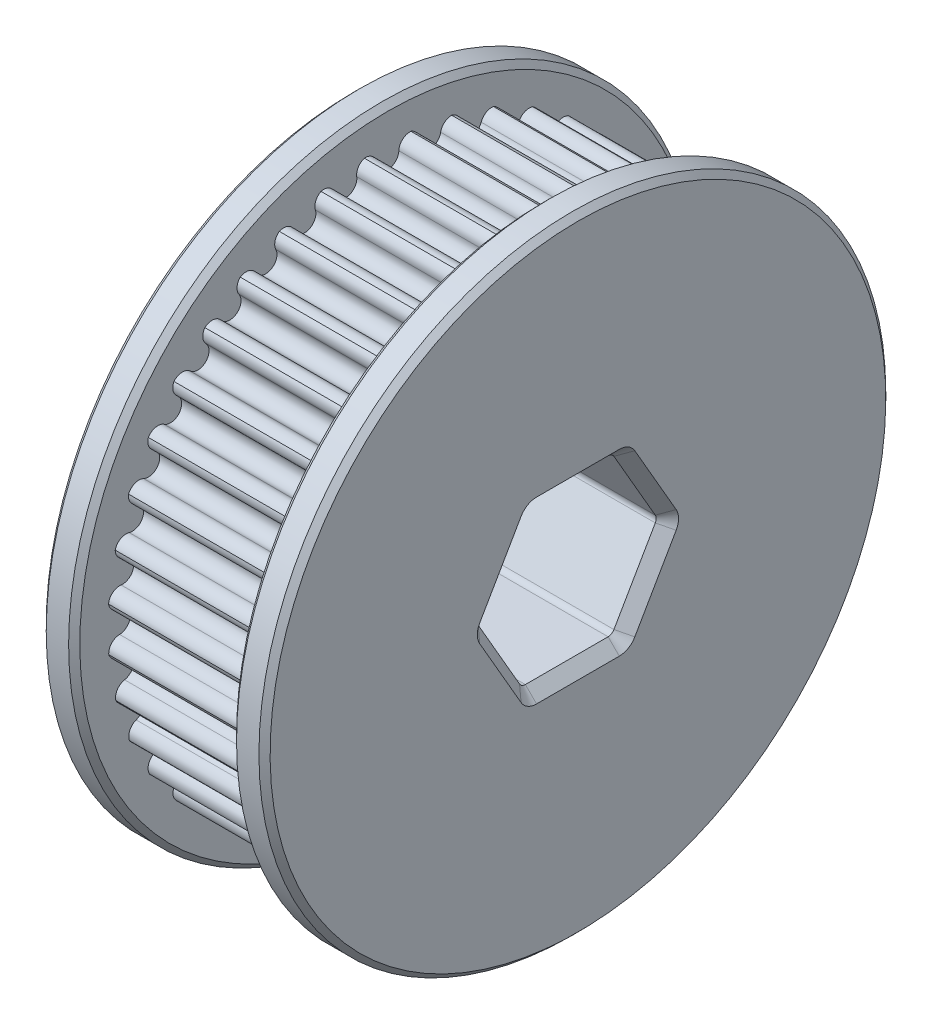
from build123d import *

# Parameters (mm, degrees)
CUT_EXTRUDE1_START       = -16.5
CUT_EXTRUDE1_OUTLINE_R   = 4
CUT_EXTRUDE1_DEPTH       = 9.5
CUT_EXTRUDE1_START_2     = -16.75
CUT_EXTRUDE1_2_OUTLINE_R = 14
CUT_EXTRUDE1_2_DEPTH     = 1
CUT_EXTRUDE1_START_3     = -8.25
CUT_EXTRUDE1_3_OUTLINE_R = 14
CUT_EXTRUDE1_3_DEPTH     = 1
SKETCH2_R                = 6.324330015
BOSS_EXTRUDE1_DEPTH      = 10
CUT_EXTRUDE2_REACH       = 24.181
CHAMFER1_SIZE            = 0.5
SKETCH4_R                = 5.85
SKETCH4_R_2              = 4.85
BOSS_EXTRUDE2_DEPTH      = 0.5


with BuildPart() as part:
    # Cut-Extrude1: read off the stored shape, not the designer's step
    # Cut-Extrude1 outline → Cut-Extrude1 (new body)
    with BuildSketch(Plane(origin=(17, 0, 0), x_dir=(0, 0, -1), z_dir=(1, 0, 0)).offset(CUT_EXTRUDE1_START)):
        with BuildLine():
            ThreePointArc((1.041143378, 12.456565356), (0.66686285, 12.331604355), (0.499748821, 11.974149369))
            ThreePointArc((0.499748821, 11.974149369), (0, 11.489995997), (-0.499748821, 11.974149369))
            ThreePointArc((-0.499748821, 11.974149369), (-0.66686285, 12.331604355), (-1.041143378, 12.456565356))
            ThreePointArc((-1.041143378, 12.456565356), (-1.309730051, 12.245866404), (-1.380507466, 11.9119152))
            ThreePointArc((-1.380507466, 11.9119152), (-1.793941124, 11.349100539), (-2.366765735, 11.748549781))
            ThreePointArc((-2.366765735, 11.748549781), (-2.587740592, 12.075461509), (-2.976961313, 12.140333659))
            ThreePointArc((-2.976961313, 12.140333659), (-3.20928066, 11.890212548), (-3.226945211, 11.54930081))
            ThreePointArc((-3.226945211, 11.54930081), (-3.547245203, 10.928740058), (-4.175505021, 11.233661906))
            ThreePointArc((-4.175505021, 11.233661906), (-4.444899572, 11.521980725), (-4.83947658, 11.525166655))
            ThreePointArc((-4.83947658, 11.525166655), (-5.029808129, 11.241782197), (-4.993924854, 10.902304304))
            ThreePointArc((-4.993924854, 10.902304304), (-5.213204333, 10.239277727), (-5.881429516, 10.442163992))
            ThreePointArc((-5.881429516, 10.442163992), (-6.192610373, 10.684790536), (-6.582827873, 10.626211799))
            ThreePointArc((-6.582827873, 10.626211799), (-6.726485029, 10.31654186), (-6.637937494, 9.986856884))
            ThreePointArc((-6.637937494, 9.986856884), (-6.750797071, 9.297690396), (-7.442533697, 9.393545346))
            ThreePointArc((-7.442533697, 9.393545346), (-7.787838555, 9.584505343), (-8.164088097, 9.465604342))
            ThreePointArc((-8.164088097, 9.465604342), (-8.257533543, 9.137274024), (-8.118502082, 8.825499903))
            ThreePointArc((-8.118502082, 8.825499903), (-8.122162779, 8.127163071), (-8.820377998, 8.113626438))
            ThreePointArc((-8.820377998, 8.113626438), (-9.191304305, 8.248217819), (-9.544321376, 8.071922291))
            ThreePointArc((-9.544321376, 8.071922291), (-9.585254176, 7.733016176), (-9.399162206, 7.446829824))
            ThreePointArc((-9.399162206, 7.446829824), (-9.293533885, 6.756518017), (-9.98103532, 6.633923119))
            ThreePointArc((-9.98103532, 6.633923119), (-10.36844964, 6.708831799), (-10.689541787, 6.479482724))
            ThreePointArc((-10.689541787, 6.479482724), (-10.67695404, 6.138345804), (-10.448383761, 5.88479408))
            ThreePointArc((-10.448383761, 5.88479408), (-10.236067343, 5.219505067), (-10.895926427, 4.990870596))
            ThreePointArc((-10.895926427, 4.990870596), (-11.290289332, 5.004252074), (-11.571550203, 4.727496789))
            ThreePointArc((-11.571550203, 4.727496789), (-11.50575186, 4.392528988), (-11.240331433, 4.177855175))
            ThreePointArc((-11.240331433, 4.177855175), (-10.926554851, 3.55397058), (-11.542523663, 3.224926275))
            ThreePointArc((-11.542523663, 3.224926275), (-11.934124632, 3.176451055), (-12.16862865, 2.859104193))
            ThreePointArc((-12.16862865, 2.859104193), (-12.051239885, 2.53855353), (-11.75550484, 2.368043611))
            ThreePointArc((-11.75550484, 2.368043611), (-11.347994316, 1.800925542), (-11.90490566, 1.379573567))
            ThreePointArc((-11.90490566, 1.379573567), (-12.284102175, 1.270435269), (-12.466075073, 0.920310963))
            ThreePointArc((-12.466075073, 0.920310963), (-12.299986388, 0.622070459), (-11.981218704, 0.499922953))
            ThreePointArc((-11.981218704, 0.499922953), (-11.490008498, 0.00353574), (-11.974149369, -0.499748821))
            ThreePointArc((-11.974149369, -0.499748821), (-12.331604355, -0.66686285), (-12.456565356, -1.041143378))
            ThreePointArc((-12.456565356, -1.041143378), (-12.245866404, -1.309730051), (-11.9119152, -1.380507466))
            ThreePointArc((-11.9119152, -1.380507466), (-11.349100539, -1.793941124), (-11.748549781, -2.366765735))
            ThreePointArc((-11.748549781, -2.366765735), (-12.075461509, -2.587740592), (-12.140333659, -2.976961313))
            ThreePointArc((-12.140333659, -2.976961313), (-11.890212548, -3.20928066), (-11.54930081, -3.226945211))
            ThreePointArc((-11.54930081, -3.226945211), (-10.928740058, -3.547245203), (-11.233661906, -4.175505021))
            ThreePointArc((-11.233661906, -4.175505021), (-11.521980725, -4.444899572), (-11.525166655, -4.83947658))
            ThreePointArc((-11.525166655, -4.83947658), (-11.241782197, -5.029808129), (-10.902304304, -4.993924854))
            ThreePointArc((-10.902304304, -4.993924854), (-10.239277727, -5.213204333), (-10.442163992, -5.881429516))
            ThreePointArc((-10.442163992, -5.881429516), (-10.684790536, -6.192610373), (-10.626211799, -6.582827873))
            ThreePointArc((-10.626211799, -6.582827873), (-10.31654186, -6.726485029), (-9.986856884, -6.637937494))
            ThreePointArc((-9.986856884, -6.637937494), (-9.297690396, -6.750797071), (-9.393545346, -7.442533697))
            ThreePointArc((-9.393545346, -7.442533697), (-9.584505343, -7.787838555), (-9.465604342, -8.164088097))
            ThreePointArc((-9.465604342, -8.164088097), (-9.137274024, -8.257533543), (-8.825499903, -8.118502082))
            ThreePointArc((-8.825499903, -8.118502082), (-8.127163071, -8.122162779), (-8.113626438, -8.820377998))
            ThreePointArc((-8.113626438, -8.820377998), (-8.248217819, -9.191304305), (-8.071922291, -9.544321376))
            ThreePointArc((-8.071922291, -9.544321376), (-7.733016176, -9.585254176), (-7.446829824, -9.399162206))
            ThreePointArc((-7.446829824, -9.399162206), (-6.756518017, -9.293533885), (-6.633923119, -9.98103532))
            ThreePointArc((-6.633923119, -9.98103532), (-6.708831799, -10.36844964), (-6.479482724, -10.689541787))
            ThreePointArc((-6.479482724, -10.689541787), (-6.138345804, -10.67695404), (-5.88479408, -10.448383761))
            ThreePointArc((-5.88479408, -10.448383761), (-5.219505067, -10.236067343), (-4.990870596, -10.895926427))
            ThreePointArc((-4.990870596, -10.895926427), (-5.004252074, -11.290289332), (-4.727496789, -11.571550203))
            ThreePointArc((-4.727496789, -11.571550203), (-4.392528988, -11.50575186), (-4.177855175, -11.240331433))
            ThreePointArc((-4.177855175, -11.240331433), (-3.55397058, -10.926554851), (-3.224926275, -11.542523663))
            ThreePointArc((-3.224926275, -11.542523663), (-3.176451055, -11.934124632), (-2.859104193, -12.16862865))
            ThreePointArc((-2.859104193, -12.16862865), (-2.53855353, -12.051239885), (-2.368043611, -11.75550484))
            ThreePointArc((-2.368043611, -11.75550484), (-1.800925542, -11.347994316), (-1.379573567, -11.90490566))
            ThreePointArc((-1.379573567, -11.90490566), (-1.270435269, -12.284102175), (-0.920310963, -12.466075073))
            ThreePointArc((-0.920310963, -12.466075073), (-0.622070459, -12.299986388), (-0.499922953, -11.981218704))
            ThreePointArc((-0.499922953, -11.981218704), (-0.00353574, -11.490008498), (0.499748821, -11.974149369))
            ThreePointArc((0.499748821, -11.974149369), (0.66686285, -12.331604355), (1.041143378, -12.456565356))
            ThreePointArc((1.041143378, -12.456565356), (1.309730051, -12.245866404), (1.380507466, -11.9119152))
            ThreePointArc((1.380507466, -11.9119152), (1.793941124, -11.349100539), (2.366765735, -11.748549781))
            ThreePointArc((2.366765735, -11.748549781), (2.587740592, -12.075461509), (2.976961313, -12.140333659))
            ThreePointArc((2.976961313, -12.140333659), (3.20928066, -11.890212548), (3.226945211, -11.54930081))
            ThreePointArc((3.226945211, -11.54930081), (3.547245203, -10.928740058), (4.175505021, -11.233661906))
            ThreePointArc((4.175505021, -11.233661906), (4.444899572, -11.521980725), (4.83947658, -11.525166655))
            ThreePointArc((4.83947658, -11.525166655), (5.029808129, -11.241782197), (4.993924854, -10.902304304))
            ThreePointArc((4.993924854, -10.902304304), (5.213204333, -10.239277727), (5.881429516, -10.442163992))
            ThreePointArc((5.881429516, -10.442163992), (6.192610373, -10.684790536), (6.582827873, -10.626211799))
            ThreePointArc((6.582827873, -10.626211799), (6.726485029, -10.31654186), (6.637937494, -9.986856884))
            ThreePointArc((6.637937494, -9.986856884), (6.750797071, -9.297690396), (7.442533697, -9.393545346))
            ThreePointArc((7.442533697, -9.393545346), (7.787838555, -9.584505343), (8.164088097, -9.465604342))
            ThreePointArc((8.164088097, -9.465604342), (8.257533543, -9.137274024), (8.118502082, -8.825499903))
            ThreePointArc((8.118502082, -8.825499903), (8.122162779, -8.127163071), (8.820377998, -8.113626438))
            ThreePointArc((8.820377998, -8.113626438), (9.191304305, -8.248217819), (9.544321376, -8.071922291))
            ThreePointArc((9.544321376, -8.071922291), (9.585254176, -7.733016176), (9.399162206, -7.446829824))
            ThreePointArc((9.399162206, -7.446829824), (9.293533885, -6.756518017), (9.98103532, -6.633923119))
            ThreePointArc((9.98103532, -6.633923119), (10.36844964, -6.708831799), (10.689541787, -6.479482724))
            ThreePointArc((10.689541787, -6.479482724), (10.67695404, -6.138345804), (10.448383761, -5.88479408))
            ThreePointArc((10.448383761, -5.88479408), (10.236067343, -5.219505067), (10.895926427, -4.990870596))
            ThreePointArc((10.895926427, -4.990870596), (11.290289332, -5.004252074), (11.571550203, -4.727496789))
            ThreePointArc((11.571550203, -4.727496789), (11.50575186, -4.392528988), (11.240331433, -4.177855175))
            ThreePointArc((11.240331433, -4.177855175), (10.926554851, -3.55397058), (11.542523663, -3.224926275))
            ThreePointArc((11.542523663, -3.224926275), (11.934124632, -3.176451055), (12.16862865, -2.859104193))
            ThreePointArc((12.16862865, -2.859104193), (12.051239885, -2.53855353), (11.75550484, -2.368043611))
            ThreePointArc((11.75550484, -2.368043611), (11.347994316, -1.800925542), (11.90490566, -1.379573567))
            ThreePointArc((11.90490566, -1.379573567), (12.284102175, -1.270435269), (12.466075073, -0.920310963))
            ThreePointArc((12.466075073, -0.920310963), (12.299986388, -0.622070459), (11.981218704, -0.499922953))
            ThreePointArc((11.981218704, -0.499922953), (11.490008498, -0.00353574), (11.974149369, 0.499748821))
            ThreePointArc((11.974149369, 0.499748821), (12.331604355, 0.66686285), (12.456565356, 1.041143378))
            ThreePointArc((12.456565356, 1.041143378), (12.245866404, 1.309730051), (11.9119152, 1.380507466))
            ThreePointArc((11.9119152, 1.380507466), (11.349100539, 1.793941124), (11.748549781, 2.366765735))
            ThreePointArc((11.748549781, 2.366765735), (12.075461509, 2.587740592), (12.140333659, 2.976961313))
            ThreePointArc((12.140333659, 2.976961313), (11.890212548, 3.20928066), (11.54930081, 3.226945211))
            ThreePointArc((11.54930081, 3.226945211), (10.928740058, 3.547245203), (11.233661906, 4.175505021))
            ThreePointArc((11.233661906, 4.175505021), (11.521980725, 4.444899572), (11.525166655, 4.83947658))
            ThreePointArc((11.525166655, 4.83947658), (11.241782197, 5.029808129), (10.902304304, 4.993924854))
            ThreePointArc((10.902304304, 4.993924854), (10.239277727, 5.213204333), (10.442163992, 5.881429516))
            ThreePointArc((10.442163992, 5.881429516), (10.684790536, 6.192610373), (10.626211799, 6.582827873))
            ThreePointArc((10.626211799, 6.582827873), (10.31654186, 6.726485029), (9.986856884, 6.637937494))
            ThreePointArc((9.986856884, 6.637937494), (9.297690396, 6.750797071), (9.393545346, 7.442533697))
            ThreePointArc((9.393545346, 7.442533697), (9.584505343, 7.787838555), (9.465604342, 8.164088097))
            ThreePointArc((9.465604342, 8.164088097), (9.137274024, 8.257533543), (8.825499903, 8.118502082))
            ThreePointArc((8.825499903, 8.118502082), (8.127163071, 8.122162779), (8.113626438, 8.820377998))
            ThreePointArc((8.113626438, 8.820377998), (8.248217819, 9.191304305), (8.071922291, 9.544321376))
            ThreePointArc((8.071922291, 9.544321376), (7.733016176, 9.585254176), (7.446829824, 9.399162206))
            ThreePointArc((7.446829824, 9.399162206), (6.756518017, 9.293533885), (6.633923119, 9.98103532))
            ThreePointArc((6.633923119, 9.98103532), (6.708831799, 10.36844964), (6.479482724, 10.689541787))
            ThreePointArc((6.479482724, 10.689541787), (6.138345804, 10.67695404), (5.88479408, 10.448383761))
            ThreePointArc((5.88479408, 10.448383761), (5.219505067, 10.236067343), (4.990870596, 10.895926427))
            ThreePointArc((4.990870596, 10.895926427), (5.004252074, 11.290289332), (4.727496789, 11.571550203))
            ThreePointArc((4.727496789, 11.571550203), (4.392528988, 11.50575186), (4.177855175, 11.240331433))
            ThreePointArc((4.177855175, 11.240331433), (3.55397058, 10.926554851), (3.224926275, 11.542523663))
            ThreePointArc((3.224926275, 11.542523663), (3.176451055, 11.934124632), (2.859104193, 12.16862865))
            ThreePointArc((2.859104193, 12.16862865), (2.53855353, 12.051239885), (2.368043611, 11.75550484))
            ThreePointArc((2.368043611, 11.75550484), (1.797431377, 11.34853508), (1.380507466, 11.9119152))
            ThreePointArc((1.380507466, 11.9119152), (1.309730051, 12.245866404), (1.041143378, 12.456565356))
        make_face()
        Circle(CUT_EXTRUDE1_OUTLINE_R, mode=Mode.SUBTRACT)
    extrude(amount=CUT_EXTRUDE1_DEPTH)

    # Cut-Extrude1 2 outline → Cut-Extrude1 2 (add)
    with BuildSketch(Plane(origin=(17, 0, 0), x_dir=(0, 0, -1), z_dir=(1, 0, 0)).offset(CUT_EXTRUDE1_START_2)):
        Circle(CUT_EXTRUDE1_2_OUTLINE_R)
        with BuildLine():
            ThreePointArc((-0.499748821, 11.974149369), (0, 11.489995997), (0.499748821, 11.974149369))
            ThreePointArc((0.499748821, 11.974149369), (0.66686285, 12.331604355), (1.041143378, 12.456565356))
            ThreePointArc((1.041143378, 12.456565356), (1.309730051, 12.245866404), (1.380507466, 11.9119152))
            ThreePointArc((1.380507466, 11.9119152), (1.797431377, 11.34853508), (2.368043611, 11.75550484))
            ThreePointArc((2.368043611, 11.75550484), (2.53855353, 12.051239885), (2.859104193, 12.16862865))
            ThreePointArc((2.859104193, 12.16862865), (3.176451055, 11.934124632), (3.224926275, 11.542523663))
            ThreePointArc((3.224926275, 11.542523663), (3.55397058, 10.926554851), (4.177855175, 11.240331433))
            ThreePointArc((4.177855175, 11.240331433), (4.392528988, 11.50575186), (4.727496789, 11.571550204))
            ThreePointArc((4.727496789, 11.571550204), (5.004252074, 11.290289332), (4.990870596, 10.895926427))
            ThreePointArc((4.990870596, 10.895926427), (5.219505067, 10.236067343), (5.88479408, 10.448383761))
            ThreePointArc((5.88479408, 10.448383761), (6.138345804, 10.67695404), (6.479482724, 10.689541788))
            ThreePointArc((6.479482724, 10.689541788), (6.708831799, 10.36844964), (6.633923119, 9.98103532))
            ThreePointArc((6.633923119, 9.98103532), (6.756518017, 9.293533885), (7.446829824, 9.399162206))
            ThreePointArc((7.446829824, 9.399162206), (7.733016176, 9.585254176), (8.071922291, 9.544321376))
            ThreePointArc((8.071922291, 9.544321376), (8.248217819, 9.191304305), (8.113626438, 8.820377998))
            ThreePointArc((8.113626438, 8.820377998), (8.127163071, 8.122162779), (8.825499903, 8.118502082))
            ThreePointArc((8.825499903, 8.118502082), (9.137274024, 8.257533543), (9.465604342, 8.164088097))
            ThreePointArc((9.465604342, 8.164088097), (9.584505343, 7.787838555), (9.393545346, 7.442533697))
            ThreePointArc((9.393545346, 7.442533697), (9.297690396, 6.750797071), (9.986856884, 6.637937494))
            ThreePointArc((9.986856884, 6.637937494), (10.31654186, 6.726485029), (10.626211799, 6.582827873))
            ThreePointArc((10.626211799, 6.582827873), (10.684790536, 6.192610373), (10.442163992, 5.881429516))
            ThreePointArc((10.442163992, 5.881429516), (10.239277727, 5.213204333), (10.902304304, 4.993924854))
            ThreePointArc((10.902304304, 4.993924854), (11.241782197, 5.029808129), (11.525166655, 4.83947658))
            ThreePointArc((11.525166655, 4.83947658), (11.521980725, 4.444899572), (11.233661906, 4.175505021))
            ThreePointArc((11.233661906, 4.175505021), (10.928740058, 3.547245203), (11.54930081, 3.226945211))
            ThreePointArc((11.54930081, 3.226945211), (11.890212548, 3.20928066), (12.140333659, 2.976961313))
            ThreePointArc((12.140333659, 2.976961313), (12.075461509, 2.587740592), (11.748549781, 2.366765735))
            ThreePointArc((11.748549781, 2.366765735), (11.349100539, 1.793941124), (11.9119152, 1.380507466))
            ThreePointArc((11.9119152, 1.380507466), (12.245866404, 1.309730051), (12.456565356, 1.041143378))
            ThreePointArc((12.456565356, 1.041143378), (12.331604355, 0.66686285), (11.974149369, 0.499748821))
            ThreePointArc((11.974149369, 0.499748821), (11.490008498, -0.00353574), (11.981218704, -0.499922953))
            ThreePointArc((11.981218704, -0.499922953), (12.299986388, -0.622070459), (12.466075073, -0.920310963))
            ThreePointArc((12.466075073, -0.920310963), (12.284102175, -1.270435269), (11.90490566, -1.379573567))
            ThreePointArc((11.90490566, -1.379573567), (11.347994316, -1.800925542), (11.75550484, -2.368043611))
            ThreePointArc((11.75550484, -2.368043611), (12.051239885, -2.53855353), (12.16862865, -2.859104193))
            ThreePointArc((12.16862865, -2.859104193), (11.934124632, -3.176451055), (11.542523663, -3.224926275))
            ThreePointArc((11.542523663, -3.224926275), (10.926554851, -3.55397058), (11.240331433, -4.177855175))
            ThreePointArc((11.240331433, -4.177855175), (11.50575186, -4.392528988), (11.571550204, -4.727496789))
            ThreePointArc((11.571550204, -4.727496789), (11.290289332, -5.004252074), (10.895926427, -4.990870596))
            ThreePointArc((10.895926427, -4.990870596), (10.236067343, -5.219505067), (10.448383761, -5.88479408))
            ThreePointArc((10.448383761, -5.88479408), (10.67695404, -6.138345804), (10.689541788, -6.479482724))
            ThreePointArc((10.689541788, -6.479482724), (10.36844964, -6.708831799), (9.98103532, -6.633923119))
            ThreePointArc((9.98103532, -6.633923119), (9.293533885, -6.756518017), (9.399162206, -7.446829824))
            ThreePointArc((9.399162206, -7.446829824), (9.585254176, -7.733016176), (9.544321376, -8.071922291))
            ThreePointArc((9.544321376, -8.071922291), (9.191304305, -8.248217819), (8.820377998, -8.113626438))
            ThreePointArc((8.820377998, -8.113626438), (8.122162779, -8.127163071), (8.118502082, -8.825499903))
            ThreePointArc((8.118502082, -8.825499903), (8.257533543, -9.137274024), (8.164088097, -9.465604342))
            ThreePointArc((8.164088097, -9.465604342), (7.787838555, -9.584505343), (7.442533697, -9.393545346))
            ThreePointArc((7.442533697, -9.393545346), (6.750797071, -9.297690396), (6.637937494, -9.986856884))
            ThreePointArc((6.637937494, -9.986856884), (6.726485029, -10.31654186), (6.582827873, -10.626211799))
            ThreePointArc((6.582827873, -10.626211799), (6.192610373, -10.684790536), (5.881429516, -10.442163992))
            ThreePointArc((5.881429516, -10.442163992), (5.213204333, -10.239277727), (4.993924854, -10.902304304))
            ThreePointArc((4.993924854, -10.902304304), (5.029808129, -11.241782197), (4.83947658, -11.525166655))
            ThreePointArc((4.83947658, -11.525166655), (4.444899572, -11.521980725), (4.175505021, -11.233661906))
            ThreePointArc((4.175505021, -11.233661906), (3.547245203, -10.928740058), (3.226945211, -11.54930081))
            ThreePointArc((3.226945211, -11.54930081), (3.20928066, -11.890212548), (2.976961313, -12.140333659))
            ThreePointArc((2.976961313, -12.140333659), (2.587740592, -12.075461509), (2.366765735, -11.748549781))
            ThreePointArc((2.366765735, -11.748549781), (1.793941124, -11.349100539), (1.380507466, -11.9119152))
            ThreePointArc((1.380507466, -11.9119152), (1.309730051, -12.245866404), (1.041143378, -12.456565356))
            ThreePointArc((1.041143378, -12.456565356), (0.66686285, -12.331604355), (0.499748821, -11.974149369))
            ThreePointArc((0.499748821, -11.974149369), (-0.00353574, -11.490008498), (-0.499922953, -11.981218704))
            ThreePointArc((-0.499922953, -11.981218704), (-0.622070459, -12.299986388), (-0.920310963, -12.466075073))
            ThreePointArc((-0.920310963, -12.466075073), (-1.270435269, -12.284102175), (-1.379573567, -11.90490566))
            ThreePointArc((-1.379573567, -11.90490566), (-1.800925542, -11.347994316), (-2.368043611, -11.75550484))
            ThreePointArc((-2.368043611, -11.75550484), (-2.53855353, -12.051239885), (-2.859104193, -12.16862865))
            ThreePointArc((-2.859104193, -12.16862865), (-3.176451055, -11.934124632), (-3.224926275, -11.542523663))
            ThreePointArc((-3.224926275, -11.542523663), (-3.55397058, -10.926554851), (-4.177855175, -11.240331433))
            ThreePointArc((-4.177855175, -11.240331433), (-4.392528988, -11.50575186), (-4.727496789, -11.571550204))
            ThreePointArc((-4.727496789, -11.571550204), (-5.004252074, -11.290289332), (-4.990870596, -10.895926427))
            ThreePointArc((-4.990870596, -10.895926427), (-5.219505067, -10.236067343), (-5.88479408, -10.448383761))
            ThreePointArc((-5.88479408, -10.448383761), (-6.138345804, -10.67695404), (-6.479482724, -10.689541788))
            ThreePointArc((-6.479482724, -10.689541788), (-6.708831799, -10.36844964), (-6.633923119, -9.98103532))
            ThreePointArc((-6.633923119, -9.98103532), (-6.756518017, -9.293533885), (-7.446829824, -9.399162206))
            ThreePointArc((-7.446829824, -9.399162206), (-7.733016176, -9.585254176), (-8.071922291, -9.544321376))
            ThreePointArc((-8.071922291, -9.544321376), (-8.248217819, -9.191304305), (-8.113626438, -8.820377998))
            ThreePointArc((-8.113626438, -8.820377998), (-8.127163071, -8.122162779), (-8.825499903, -8.118502082))
            ThreePointArc((-8.825499903, -8.118502082), (-9.137274024, -8.257533543), (-9.465604342, -8.164088097))
            ThreePointArc((-9.465604342, -8.164088097), (-9.584505343, -7.787838555), (-9.393545346, -7.442533697))
            ThreePointArc((-9.393545346, -7.442533697), (-9.297690396, -6.750797071), (-9.986856884, -6.637937494))
            ThreePointArc((-9.986856884, -6.637937494), (-10.31654186, -6.726485029), (-10.626211799, -6.582827873))
            ThreePointArc((-10.626211799, -6.582827873), (-10.684790536, -6.192610373), (-10.442163992, -5.881429516))
            ThreePointArc((-10.442163992, -5.881429516), (-10.239277727, -5.213204333), (-10.902304304, -4.993924854))
            ThreePointArc((-10.902304304, -4.993924854), (-11.241782197, -5.029808129), (-11.525166655, -4.83947658))
            ThreePointArc((-11.525166655, -4.83947658), (-11.521980725, -4.444899572), (-11.233661906, -4.175505021))
            ThreePointArc((-11.233661906, -4.175505021), (-10.928740058, -3.547245203), (-11.54930081, -3.226945211))
            ThreePointArc((-11.54930081, -3.226945211), (-11.890212548, -3.20928066), (-12.140333659, -2.976961313))
            ThreePointArc((-12.140333659, -2.976961313), (-12.075461509, -2.587740592), (-11.748549781, -2.366765735))
            ThreePointArc((-11.748549781, -2.366765735), (-11.349100539, -1.793941124), (-11.9119152, -1.380507466))
            ThreePointArc((-11.9119152, -1.380507466), (-12.245866404, -1.309730051), (-12.456565356, -1.041143378))
            ThreePointArc((-12.456565356, -1.041143378), (-12.331604355, -0.66686285), (-11.974149369, -0.499748821))
            ThreePointArc((-11.974149369, -0.499748821), (-11.490008498, 0.00353574), (-11.981218704, 0.499922953))
            ThreePointArc((-11.981218704, 0.499922953), (-12.299986388, 0.622070459), (-12.466075073, 0.920310963))
            ThreePointArc((-12.466075073, 0.920310963), (-12.284102175, 1.270435269), (-11.90490566, 1.379573567))
            ThreePointArc((-11.90490566, 1.379573567), (-11.347994316, 1.800925542), (-11.75550484, 2.368043611))
            ThreePointArc((-11.75550484, 2.368043611), (-12.051239885, 2.53855353), (-12.16862865, 2.859104193))
            ThreePointArc((-12.16862865, 2.859104193), (-11.934124632, 3.176451055), (-11.542523663, 3.224926275))
            ThreePointArc((-11.542523663, 3.224926275), (-10.926554851, 3.55397058), (-11.240331433, 4.177855175))
            ThreePointArc((-11.240331433, 4.177855175), (-11.50575186, 4.392528988), (-11.571550204, 4.727496789))
            ThreePointArc((-11.571550204, 4.727496789), (-11.290289332, 5.004252074), (-10.895926427, 4.990870596))
            ThreePointArc((-10.895926427, 4.990870596), (-10.236067343, 5.219505067), (-10.448383761, 5.88479408))
            ThreePointArc((-10.448383761, 5.88479408), (-10.67695404, 6.138345804), (-10.689541788, 6.479482724))
            ThreePointArc((-10.689541788, 6.479482724), (-10.36844964, 6.708831799), (-9.98103532, 6.633923119))
            ThreePointArc((-9.98103532, 6.633923119), (-9.293533885, 6.756518017), (-9.399162206, 7.446829824))
            ThreePointArc((-9.399162206, 7.446829824), (-9.585254176, 7.733016176), (-9.544321376, 8.071922291))
            ThreePointArc((-9.544321376, 8.071922291), (-9.191304305, 8.248217819), (-8.820377998, 8.113626438))
            ThreePointArc((-8.820377998, 8.113626438), (-8.122162779, 8.127163071), (-8.118502082, 8.825499903))
            ThreePointArc((-8.118502082, 8.825499903), (-8.257533543, 9.137274024), (-8.164088097, 9.465604342))
            ThreePointArc((-8.164088097, 9.465604342), (-7.787838555, 9.584505343), (-7.442533697, 9.393545346))
            ThreePointArc((-7.442533697, 9.393545346), (-6.750797071, 9.297690396), (-6.637937494, 9.986856884))
            ThreePointArc((-6.637937494, 9.986856884), (-6.726485029, 10.31654186), (-6.582827873, 10.626211799))
            ThreePointArc((-6.582827873, 10.626211799), (-6.192610373, 10.684790536), (-5.881429516, 10.442163992))
            ThreePointArc((-5.881429516, 10.442163992), (-5.213204333, 10.239277727), (-4.993924854, 10.902304304))
            ThreePointArc((-4.993924854, 10.902304304), (-5.029808129, 11.241782197), (-4.83947658, 11.525166655))
            ThreePointArc((-4.83947658, 11.525166655), (-4.444899572, 11.521980725), (-4.175505021, 11.233661906))
            ThreePointArc((-4.175505021, 11.233661906), (-3.547245203, 10.928740058), (-3.226945211, 11.54930081))
            ThreePointArc((-3.226945211, 11.54930081), (-3.20928066, 11.890212548), (-2.976961313, 12.140333659))
            ThreePointArc((-2.976961313, 12.140333659), (-2.587740592, 12.075461509), (-2.366765735, 11.748549781))
            ThreePointArc((-2.366765735, 11.748549781), (-1.793941124, 11.349100539), (-1.380507466, 11.9119152))
            ThreePointArc((-1.380507466, 11.9119152), (-1.309730051, 12.245866404), (-1.041143378, 12.456565356))
            ThreePointArc((-1.041143378, 12.456565356), (-0.66686285, 12.331604355), (-0.499748821, 11.974149369))
        make_face(mode=Mode.SUBTRACT)
    extrude(amount=CUT_EXTRUDE1_2_DEPTH)

    # Cut-Extrude1 3 outline → Cut-Extrude1 3 (add)
    with BuildSketch(Plane(origin=(17, 0, 0), x_dir=(0, 0, -1), z_dir=(1, 0, 0)).offset(CUT_EXTRUDE1_START_3)):
        Circle(CUT_EXTRUDE1_3_OUTLINE_R)
        with BuildLine():
            ThreePointArc((-0.499748821, 11.974149369), (0, 11.489995997), (0.499748821, 11.974149369))
            ThreePointArc((0.499748821, 11.974149369), (0.66686285, 12.331604355), (1.041143378, 12.456565356))
            ThreePointArc((1.041143378, 12.456565356), (1.309730051, 12.245866404), (1.380507466, 11.9119152))
            ThreePointArc((1.380507466, 11.9119152), (1.797431377, 11.34853508), (2.368043611, 11.75550484))
            ThreePointArc((2.368043611, 11.75550484), (2.53855353, 12.051239885), (2.859104193, 12.16862865))
            ThreePointArc((2.859104193, 12.16862865), (3.176451055, 11.934124632), (3.224926275, 11.542523663))
            ThreePointArc((3.224926275, 11.542523663), (3.55397058, 10.926554851), (4.177855175, 11.240331433))
            ThreePointArc((4.177855175, 11.240331433), (4.392528988, 11.50575186), (4.727496789, 11.571550204))
            ThreePointArc((4.727496789, 11.571550204), (5.004252074, 11.290289332), (4.990870596, 10.895926427))
            ThreePointArc((4.990870596, 10.895926427), (5.219505067, 10.236067343), (5.88479408, 10.448383761))
            ThreePointArc((5.88479408, 10.448383761), (6.138345804, 10.67695404), (6.479482724, 10.689541788))
            ThreePointArc((6.479482724, 10.689541788), (6.708831799, 10.36844964), (6.633923119, 9.98103532))
            ThreePointArc((6.633923119, 9.98103532), (6.756518017, 9.293533885), (7.446829824, 9.399162206))
            ThreePointArc((7.446829824, 9.399162206), (7.733016176, 9.585254176), (8.071922291, 9.544321376))
            ThreePointArc((8.071922291, 9.544321376), (8.248217819, 9.191304305), (8.113626438, 8.820377998))
            ThreePointArc((8.113626438, 8.820377998), (8.127163071, 8.122162779), (8.825499903, 8.118502082))
            ThreePointArc((8.825499903, 8.118502082), (9.137274024, 8.257533543), (9.465604342, 8.164088097))
            ThreePointArc((9.465604342, 8.164088097), (9.584505343, 7.787838555), (9.393545346, 7.442533697))
            ThreePointArc((9.393545346, 7.442533697), (9.297690396, 6.750797071), (9.986856884, 6.637937494))
            ThreePointArc((9.986856884, 6.637937494), (10.31654186, 6.726485029), (10.626211799, 6.582827873))
            ThreePointArc((10.626211799, 6.582827873), (10.684790536, 6.192610373), (10.442163992, 5.881429516))
            ThreePointArc((10.442163992, 5.881429516), (10.239277727, 5.213204333), (10.902304304, 4.993924854))
            ThreePointArc((10.902304304, 4.993924854), (11.241782197, 5.029808129), (11.525166655, 4.83947658))
            ThreePointArc((11.525166655, 4.83947658), (11.521980725, 4.444899572), (11.233661906, 4.175505021))
            ThreePointArc((11.233661906, 4.175505021), (10.928740058, 3.547245203), (11.54930081, 3.226945211))
            ThreePointArc((11.54930081, 3.226945211), (11.890212548, 3.20928066), (12.140333659, 2.976961313))
            ThreePointArc((12.140333659, 2.976961313), (12.075461509, 2.587740592), (11.748549781, 2.366765735))
            ThreePointArc((11.748549781, 2.366765735), (11.349100539, 1.793941124), (11.9119152, 1.380507466))
            ThreePointArc((11.9119152, 1.380507466), (12.245866404, 1.309730051), (12.456565356, 1.041143378))
            ThreePointArc((12.456565356, 1.041143378), (12.331604355, 0.66686285), (11.974149369, 0.499748821))
            ThreePointArc((11.974149369, 0.499748821), (11.490008498, -0.00353574), (11.981218704, -0.499922953))
            ThreePointArc((11.981218704, -0.499922953), (12.299986388, -0.622070459), (12.466075073, -0.920310963))
            ThreePointArc((12.466075073, -0.920310963), (12.284102175, -1.270435269), (11.90490566, -1.379573567))
            ThreePointArc((11.90490566, -1.379573567), (11.347994316, -1.800925542), (11.75550484, -2.368043611))
            ThreePointArc((11.75550484, -2.368043611), (12.051239885, -2.53855353), (12.16862865, -2.859104193))
            ThreePointArc((12.16862865, -2.859104193), (11.934124632, -3.176451055), (11.542523663, -3.224926275))
            ThreePointArc((11.542523663, -3.224926275), (10.926554851, -3.55397058), (11.240331433, -4.177855175))
            ThreePointArc((11.240331433, -4.177855175), (11.50575186, -4.392528988), (11.571550204, -4.727496789))
            ThreePointArc((11.571550204, -4.727496789), (11.290289332, -5.004252074), (10.895926427, -4.990870596))
            ThreePointArc((10.895926427, -4.990870596), (10.236067343, -5.219505067), (10.448383761, -5.88479408))
            ThreePointArc((10.448383761, -5.88479408), (10.67695404, -6.138345804), (10.689541788, -6.479482724))
            ThreePointArc((10.689541788, -6.479482724), (10.36844964, -6.708831799), (9.98103532, -6.633923119))
            ThreePointArc((9.98103532, -6.633923119), (9.293533885, -6.756518017), (9.399162206, -7.446829824))
            ThreePointArc((9.399162206, -7.446829824), (9.585254176, -7.733016176), (9.544321376, -8.071922291))
            ThreePointArc((9.544321376, -8.071922291), (9.191304305, -8.248217819), (8.820377998, -8.113626438))
            ThreePointArc((8.820377998, -8.113626438), (8.122162779, -8.127163071), (8.118502082, -8.825499903))
            ThreePointArc((8.118502082, -8.825499903), (8.257533543, -9.137274024), (8.164088097, -9.465604342))
            ThreePointArc((8.164088097, -9.465604342), (7.787838555, -9.584505343), (7.442533697, -9.393545346))
            ThreePointArc((7.442533697, -9.393545346), (6.750797071, -9.297690396), (6.637937494, -9.986856884))
            ThreePointArc((6.637937494, -9.986856884), (6.726485029, -10.31654186), (6.582827873, -10.626211799))
            ThreePointArc((6.582827873, -10.626211799), (6.192610373, -10.684790536), (5.881429516, -10.442163992))
            ThreePointArc((5.881429516, -10.442163992), (5.213204333, -10.239277727), (4.993924854, -10.902304304))
            ThreePointArc((4.993924854, -10.902304304), (5.029808129, -11.241782197), (4.83947658, -11.525166655))
            ThreePointArc((4.83947658, -11.525166655), (4.444899572, -11.521980725), (4.175505021, -11.233661906))
            ThreePointArc((4.175505021, -11.233661906), (3.547245203, -10.928740058), (3.226945211, -11.54930081))
            ThreePointArc((3.226945211, -11.54930081), (3.20928066, -11.890212548), (2.976961313, -12.140333659))
            ThreePointArc((2.976961313, -12.140333659), (2.587740592, -12.075461509), (2.366765735, -11.748549781))
            ThreePointArc((2.366765735, -11.748549781), (1.793941124, -11.349100539), (1.380507466, -11.9119152))
            ThreePointArc((1.380507466, -11.9119152), (1.309730051, -12.245866404), (1.041143378, -12.456565356))
            ThreePointArc((1.041143378, -12.456565356), (0.66686285, -12.331604355), (0.499748821, -11.974149369))
            ThreePointArc((0.499748821, -11.974149369), (-0.00353574, -11.490008498), (-0.499922953, -11.981218704))
            ThreePointArc((-0.499922953, -11.981218704), (-0.622070459, -12.299986388), (-0.920310963, -12.466075073))
            ThreePointArc((-0.920310963, -12.466075073), (-1.270435269, -12.284102175), (-1.379573567, -11.90490566))
            ThreePointArc((-1.379573567, -11.90490566), (-1.800925542, -11.347994316), (-2.368043611, -11.75550484))
            ThreePointArc((-2.368043611, -11.75550484), (-2.53855353, -12.051239885), (-2.859104193, -12.16862865))
            ThreePointArc((-2.859104193, -12.16862865), (-3.176451055, -11.934124632), (-3.224926275, -11.542523663))
            ThreePointArc((-3.224926275, -11.542523663), (-3.55397058, -10.926554851), (-4.177855175, -11.240331433))
            ThreePointArc((-4.177855175, -11.240331433), (-4.392528988, -11.50575186), (-4.727496789, -11.571550204))
            ThreePointArc((-4.727496789, -11.571550204), (-5.004252074, -11.290289332), (-4.990870596, -10.895926427))
            ThreePointArc((-4.990870596, -10.895926427), (-5.219505067, -10.236067343), (-5.88479408, -10.448383761))
            ThreePointArc((-5.88479408, -10.448383761), (-6.138345804, -10.67695404), (-6.479482724, -10.689541788))
            ThreePointArc((-6.479482724, -10.689541788), (-6.708831799, -10.36844964), (-6.633923119, -9.98103532))
            ThreePointArc((-6.633923119, -9.98103532), (-6.756518017, -9.293533885), (-7.446829824, -9.399162206))
            ThreePointArc((-7.446829824, -9.399162206), (-7.733016176, -9.585254176), (-8.071922291, -9.544321376))
            ThreePointArc((-8.071922291, -9.544321376), (-8.248217819, -9.191304305), (-8.113626438, -8.820377998))
            ThreePointArc((-8.113626438, -8.820377998), (-8.127163071, -8.122162779), (-8.825499903, -8.118502082))
            ThreePointArc((-8.825499903, -8.118502082), (-9.137274024, -8.257533543), (-9.465604342, -8.164088097))
            ThreePointArc((-9.465604342, -8.164088097), (-9.584505343, -7.787838555), (-9.393545346, -7.442533697))
            ThreePointArc((-9.393545346, -7.442533697), (-9.297690396, -6.750797071), (-9.986856884, -6.637937494))
            ThreePointArc((-9.986856884, -6.637937494), (-10.31654186, -6.726485029), (-10.626211799, -6.582827873))
            ThreePointArc((-10.626211799, -6.582827873), (-10.684790536, -6.192610373), (-10.442163992, -5.881429516))
            ThreePointArc((-10.442163992, -5.881429516), (-10.239277727, -5.213204333), (-10.902304304, -4.993924854))
            ThreePointArc((-10.902304304, -4.993924854), (-11.241782197, -5.029808129), (-11.525166655, -4.83947658))
            ThreePointArc((-11.525166655, -4.83947658), (-11.521980725, -4.444899572), (-11.233661906, -4.175505021))
            ThreePointArc((-11.233661906, -4.175505021), (-10.928740058, -3.547245203), (-11.54930081, -3.226945211))
            ThreePointArc((-11.54930081, -3.226945211), (-11.890212548, -3.20928066), (-12.140333659, -2.976961313))
            ThreePointArc((-12.140333659, -2.976961313), (-12.075461509, -2.587740592), (-11.748549781, -2.366765735))
            ThreePointArc((-11.748549781, -2.366765735), (-11.349100539, -1.793941124), (-11.9119152, -1.380507466))
            ThreePointArc((-11.9119152, -1.380507466), (-12.245866404, -1.309730051), (-12.456565356, -1.041143378))
            ThreePointArc((-12.456565356, -1.041143378), (-12.331604355, -0.66686285), (-11.974149369, -0.499748821))
            ThreePointArc((-11.974149369, -0.499748821), (-11.490008498, 0.00353574), (-11.981218704, 0.499922953))
            ThreePointArc((-11.981218704, 0.499922953), (-12.299986388, 0.622070459), (-12.466075073, 0.920310963))
            ThreePointArc((-12.466075073, 0.920310963), (-12.284102175, 1.270435269), (-11.90490566, 1.379573567))
            ThreePointArc((-11.90490566, 1.379573567), (-11.347994316, 1.800925542), (-11.75550484, 2.368043611))
            ThreePointArc((-11.75550484, 2.368043611), (-12.051239885, 2.53855353), (-12.16862865, 2.859104193))
            ThreePointArc((-12.16862865, 2.859104193), (-11.934124632, 3.176451055), (-11.542523663, 3.224926275))
            ThreePointArc((-11.542523663, 3.224926275), (-10.926554851, 3.55397058), (-11.240331433, 4.177855175))
            ThreePointArc((-11.240331433, 4.177855175), (-11.50575186, 4.392528988), (-11.571550204, 4.727496789))
            ThreePointArc((-11.571550204, 4.727496789), (-11.290289332, 5.004252074), (-10.895926427, 4.990870596))
            ThreePointArc((-10.895926427, 4.990870596), (-10.236067343, 5.219505067), (-10.448383761, 5.88479408))
            ThreePointArc((-10.448383761, 5.88479408), (-10.67695404, 6.138345804), (-10.689541788, 6.479482724))
            ThreePointArc((-10.689541788, 6.479482724), (-10.36844964, 6.708831799), (-9.98103532, 6.633923119))
            ThreePointArc((-9.98103532, 6.633923119), (-9.293533885, 6.756518017), (-9.399162206, 7.446829824))
            ThreePointArc((-9.399162206, 7.446829824), (-9.585254176, 7.733016176), (-9.544321376, 8.071922291))
            ThreePointArc((-9.544321376, 8.071922291), (-9.191304305, 8.248217819), (-8.820377998, 8.113626438))
            ThreePointArc((-8.820377998, 8.113626438), (-8.122162779, 8.127163071), (-8.118502082, 8.825499903))
            ThreePointArc((-8.118502082, 8.825499903), (-8.257533543, 9.137274024), (-8.164088097, 9.465604342))
            ThreePointArc((-8.164088097, 9.465604342), (-7.787838555, 9.584505343), (-7.442533697, 9.393545346))
            ThreePointArc((-7.442533697, 9.393545346), (-6.750797071, 9.297690396), (-6.637937494, 9.986856884))
            ThreePointArc((-6.637937494, 9.986856884), (-6.726485029, 10.31654186), (-6.582827873, 10.626211799))
            ThreePointArc((-6.582827873, 10.626211799), (-6.192610373, 10.684790536), (-5.881429516, 10.442163992))
            ThreePointArc((-5.881429516, 10.442163992), (-5.213204333, 10.239277727), (-4.993924854, 10.902304304))
            ThreePointArc((-4.993924854, 10.902304304), (-5.029808129, 11.241782197), (-4.83947658, 11.525166655))
            ThreePointArc((-4.83947658, 11.525166655), (-4.444899572, 11.521980725), (-4.175505021, 11.233661906))
            ThreePointArc((-4.175505021, 11.233661906), (-3.547245203, 10.928740058), (-3.226945211, 11.54930081))
            ThreePointArc((-3.226945211, 11.54930081), (-3.20928066, 11.890212548), (-2.976961313, 12.140333659))
            ThreePointArc((-2.976961313, 12.140333659), (-2.587740592, 12.075461509), (-2.366765735, 11.748549781))
            ThreePointArc((-2.366765735, 11.748549781), (-1.793941124, 11.349100539), (-1.380507466, 11.9119152))
            ThreePointArc((-1.380507466, 11.9119152), (-1.309730051, 12.245866404), (-1.041143378, 12.456565356))
            ThreePointArc((-1.041143378, 12.456565356), (-0.66686285, 12.331604355), (-0.499748821, 11.974149369))
        make_face(mode=Mode.SUBTRACT)
    extrude(amount=CUT_EXTRUDE1_3_DEPTH)

    # Cut-Extrude1 4 outline → Cut-Extrude1 4 (revolve)
    with BuildSketch(Plane.YX):
        Polygon((4, 0.5), (4.5, 0), (13.75, 0), (14, 0.25), (12.500000001, 0.25), (12.500000001, 0.5), align=None)
        Polygon((11.489995997, 1.5), (11.489995997, 1.25), (14, 1.25), (13.75, 1.5), align=None)
        Polygon((11.489995997, 8.75), (11.489995997, 8.5), (13.75, 8.5), (14, 8.75), align=None)
        Polygon((11.489995997, 10), (11.489995997, 9.75), (14, 9.75), (13.75, 10), align=None)
    revolve(axis=Axis((0, 0, 0), (1, 0, 0)))

    # Sketch2 → Boss-Extrude1 (add)
    with BuildSketch(Plane(origin=(10, 0, 0), x_dir=(0, 0, -1), z_dir=(1, 0, 0))):
        Circle(SKETCH2_R)
    extrude(amount=-BOSS_EXTRUDE1_DEPTH)

    # Sketch3 → Cut-Extrude2 (cut, up to next)
    with BuildSketch(Plane.ZY, mode=Mode.PRIVATE) as cut_extrude2_sk1:
        with BuildLine():
            Line((3.954849344, 0.15), (2.107328483, 3.35))
            ThreePointArc((2.107328483, 3.35), (1.997520861, 3.459807621), (1.847520861, 3.5))
            Line((1.847520861, 3.5), (-1.847520861, 3.5))
            ThreePointArc((-1.847520861, 3.5), (-1.997520861, 3.459807621), (-2.107328483, 3.35))
            Line((-2.107328483, 3.35), (-3.954849344, 0.15))
            ThreePointArc((-3.954849344, 0.15), (-3.995041723, 0), (-3.954849344, -0.15))
            Line((-3.954849344, -0.15), (-2.107328483, -3.35))
            ThreePointArc((-2.107328483, -3.35), (-1.997520861, -3.459807621), (-1.847520861, -3.5))
            Line((-1.847520861, -3.5), (1.847520861, -3.5))
            ThreePointArc((1.847520861, -3.5), (1.997520861, -3.459807621), (2.107328483, -3.35))
            Line((2.107328483, -3.35), (3.954849344, -0.15))
            ThreePointArc((3.954849344, -0.15), (3.995041723, 0), (3.954849344, 0.15))
        make_face()
    cut_extrude2_tool1 = extrude(cut_extrude2_sk1.sketch, amount=-CUT_EXTRUDE2_REACH, mode=Mode.PRIVATE) & part.part
    add(cut_extrude2_tool1.solids().sort_by_distance((0, 0, 0))[0], mode=Mode.SUBTRACT)

    # Chamfer1
    chamfer1_edges = [part.edges().sort_by_distance(p)[0] for p in [
        (10, -3.459807621, -1.997520861),
        (10, -1.75, -3.031088913),
        (10, 0, -3.995041723),
        (10, 1.75, -3.031088913),
        (10, 3.459807621, -1.997520861),
        (10, 3.5, 0),
        (10, 3.459807621, 1.997520861),
        (10, 1.75, 3.031088913),
        (10, 0, 3.995041723),
        (10, -1.75, 3.031088913),
        (10, -3.459807621, 1.997520861),
        (10, -3.5, 0),
        (0, -3.459807621, -1.997520861),
        (0, -3.5, 0),
        (0, -3.459807621, 1.997520861),
        (0, -1.75, 3.031088913),
        (0, 0, 3.995041723),
        (0, 1.75, 3.031088913),
        (0, 3.459807621, 1.997520861),
        (0, 3.5, 0),
        (0, 3.459807621, -1.997520861),
        (0, 1.75, -3.031088913),
        (0, 0, -3.995041723),
        (0, -1.75, -3.031088913),
    ]]
    chamfer(chamfer1_edges, length=CHAMFER1_SIZE)

    # Sketch4 → Boss-Extrude2 (add)
    with BuildSketch(Plane.ZY):
        Circle(SKETCH4_R)
        Circle(SKETCH4_R_2, mode=Mode.SUBTRACT)
    extrude(amount=BOSS_EXTRUDE2_DEPTH)


solid = part.part
